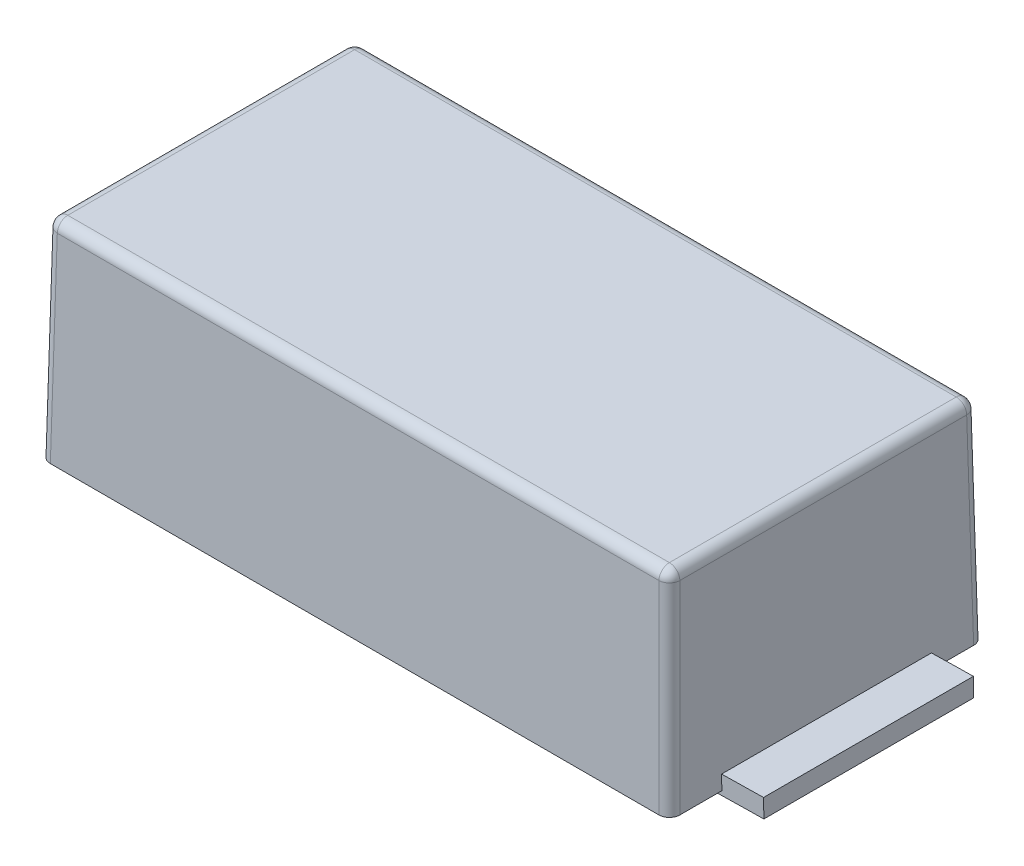
from build123d import *

# Parameters (mm, degrees)
SKETCH1_W           = 3
SKETCH1_H           = 1.5
BOSS_EXTRUDE1_DEPTH = 1
CHAMFER1_SIZE       = 1
CHAMFER1_SIZE_2     = 0.017455065
FILLET1_R           = 0.05
BOSS_EXTRUDE2_START = -0.5
SKETCH2_W           = 1
SKETCH2_H           = 0.088212482
BOSS_EXTRUDE2_DEPTH = 0.7


with BuildPart() as part:
    # Sketch1 → Boss-Extrude1 (new body)
    with BuildSketch(Plane(origin=(0, 0, 0), x_dir=(1, 0, 0), z_dir=(0, 1, 0))):
        Rectangle(SKETCH1_W, SKETCH1_H)
    extrude(amount=BOSS_EXTRUDE1_DEPTH)

    # Chamfer1
    # the kernel refuses this chamfer: 1, 0.017455065 mm, written as the material it takes off along each edge
    with BuildSketch(Plane(origin=(-1.5, 1, -3.349985355), x_dir=(-0.0006712501823120682, -0.999999774711571, 0), z_dir=(0, 0, 1)), Plane(origin=(1.5, 1, 3.349985355), x_dir=(0.0006712501823120682, -0.999999774711571, 0), z_dir=(0, 0, -1))) as chamfer1_piece_1:
        Polygon((CHAMFER1_SIZE * 0.999999774712, CHAMFER1_SIZE * 0.000671250182312), (-CHAMFER1_SIZE_2 * 0.000671250179552, CHAMFER1_SIZE_2 * 0.999999770599), (0, 0), align=None)
    extrude(amount=6.699970711, mode=Mode.SUBTRACT)
    with BuildSketch(Plane(origin=(4.099985355, 1, -0.75), x_dir=(0, -0.999999774711571, -0.0006712501823119614), z_dir=(-1, 0, 0)), Plane(origin=(-4.099985355, 1, 0.75), x_dir=(0, -0.999999774711571, 0.0006712501823119614), z_dir=(1, 0, 0))) as chamfer1_piece_2:
        Polygon((CHAMFER1_SIZE * 0.999999774712, CHAMFER1_SIZE * 0.000671250182312), (-CHAMFER1_SIZE_2 * 0.000671250179552, CHAMFER1_SIZE_2 * 0.999999770599), (0, 0), align=None)
    extrude(amount=8.199970711, mode=Mode.SUBTRACT)

    # Fillet1
    fillet1_edges = [part.edges().sort_by_distance(p)[0] for p in [
        (0, 1, 0.732544935),
        (1.482544935, 1, 0),
        (0, 1, -0.732544935),
        (-1.482544935, 1, 0),
        (1.491272468, 0.5, -0.741272468),
        (1.491272468, 0.5, 0.741272468),
        (-1.491272468, 0.5, -0.741272468),
        (-1.491272468, 0.5, 0.741272468),
    ]]
    fillet(fillet1_edges, radius=FILLET1_R)

    # Sketch2 → Boss-Extrude2 (add)
    with BuildSketch(Plane(origin=(1.49954312, 0.026174623, 0), x_dir=(0, 0, -1), z_dir=(0.9998476951563914, 0.01745240643728, 0)).offset(BOSS_EXTRUDE2_START)):
        with Locations((0, -0.002072369)):
            Rectangle(SKETCH2_W, SKETCH2_H)
    boss_extrude2 = extrude(amount=BOSS_EXTRUDE2_DEPTH)

    # Mirror1: Boss-Extrude2 across plane
    add(boss_extrude2.mirror(Plane(origin=(0, 0, 0), x_dir=(0, 0, 1), z_dir=(1, 0, 0))))


solid = part.part
